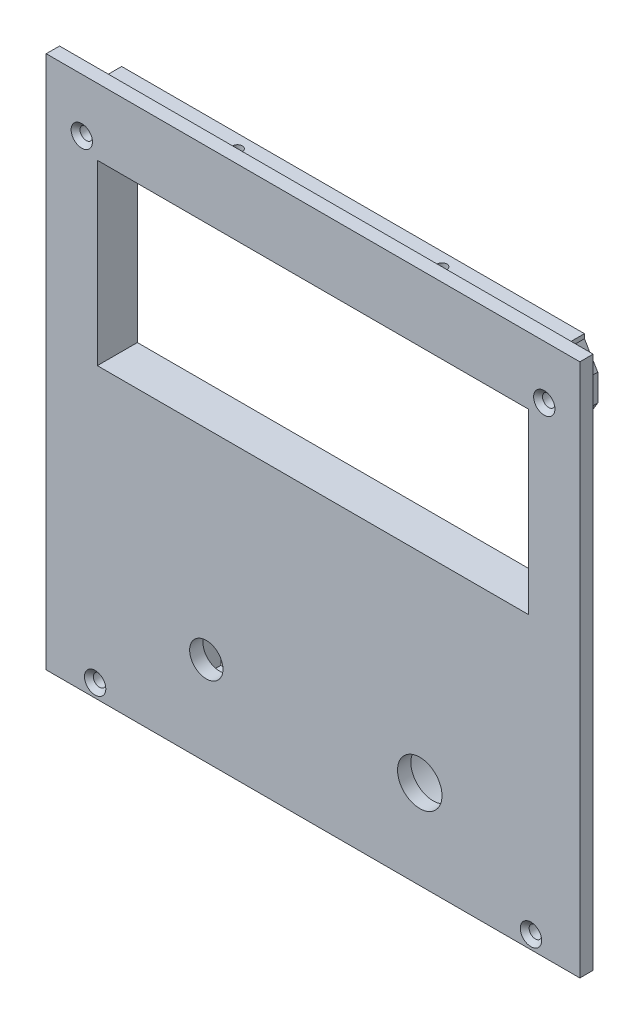
from build123d import *

# Parameters (mm, degrees)
SZKIC1_W                        = 120
SZKIC1_H                        = 120
SZKIC1_R                        = 3.75
SZKIC1_R_2                      = 5
SZKIC1_W_2                      = 97
SZKIC1_H_2                      = 40
DODANIE_WYCI_GNI_CIE1_DEPTH     = 3
SZKIC1_4_W                      = 17.2
SZKIC1_4_H                      = 32
DODANIE_WYCI_GNI_CIE3_DEPTH     = 6.5
SZKIC1_7_W                      = 97
SZKIC1_7_H                      = 40
DODANIE_WYCI_GNI_CIE4_DEPTH     = 7
SZKIC9_W                        = 40
SZKIC9_H                        = 4
WYTNIJ_WYCI_GNI_CIE10_DEPTH     = 1
SZKIC7_R                        = 1.4
WYTNIJ_WYCI_GNI_CIE11_DEPTH     = 10
SZKIC1_8_R                      = 13.25
SZKIC1_8_R_2                    = 11.25
DODANIE_WYCI_GNI_CIE5_DEPTH     = 19
SZKIC11_W                       = 17.2
SZKIC11_H                       = 3
WYTNIJ_WYCI_GNI_CIE13_DEPTH     = 4
SZKIC12_W                       = 12
SZKIC12_H                       = 19
WYTNIJ_WYCI_GNI_CIE14_DEPTH     = 4
SZKIC13_R                       = 1.1
WYTNIJ_WYCI_GNI_CIE15_DEPTH     = 7
SZKIC14_W                       = 6
SZKIC14_H                       = 6
SZKIC14_R                       = 1.1
DODANIE_WYCI_GNI_CIE6_DEPTH     = 0.8
DODANIE_WYCI_GNI_CIE7_DEPTH     = 0.8
SFAZOWANIE1_SIZE                = 1
SFAZOWANIE2_SIZE                = 1
SFAZOWANIE3_SIZE                = 1
SFAZOWANIE4_SIZE                = 1
SZKIC17_R                       = 1.4
DODANIE_WYCI_GNI_CIE9_DEPTH     = 6
SZKIC18_W                       = 99.4
SZKIC18_H                       = 63.2
WYTNIJ_WYCI_GNI_CIE16_DEPTH     = 1
WYTNIJ_WYCI_GNI_CIE17_START     = -5
WYTNIJ_WYCI_GNI_CIE17_OUTLINE_R = 1.1
WYTNIJ_WYCI_GNI_CIE17_DEPTH     = 4.2


# Read off the part's stored shape, not the designer's step: Wytnij-wyciągnięcie17
with BuildPart() as part:
    # Szkic1 → Dodanie-wyciągnięcie1 (new body)
    with BuildSketch(Plane.XY):
        with Locations((60, 60)):
            Rectangle(SZKIC1_W, SZKIC1_H)
        with Locations((36, 20)):
            Circle(SZKIC1_R, mode=Mode.SUBTRACT)
        with Locations((84, 20)):
            Circle(SZKIC1_R_2, mode=Mode.SUBTRACT)
        with Locations((60, 85)):
            Rectangle(SZKIC1_W_2, SZKIC1_H_2, mode=Mode.SUBTRACT)
    extrude(amount=DODANIE_WYCI_GNI_CIE1_DEPTH)

    # Szkic1<7> → Dodanie-wyciągnięcie4 (add)
    # profile 1 of 4: a face of its own
    with BuildSketch(Plane.XY):
        Polygon((11.5, 115), (10.3, 115), (10.3, 55), (11.5, 55), (108.5, 55), (109.7, 55), (109.7, 115), (108.5, 115), align=None)
        with Locations((60, 85)):
            Rectangle(SZKIC1_7_W, SZKIC1_7_H, mode=Mode.SUBTRACT)
    # profile 2 of 4: a face of its own
    with BuildSketch(Plane.XY):
        Polygon((11.5, 115), (10.3, 115), (10.3, 55), (11.5, 55), (108.5, 55), (109.7, 55), (109.7, 115), (108.5, 115), align=None)
        with Locations((60, 85)):
            Rectangle(SZKIC1_7_W, SZKIC1_7_H, mode=Mode.SUBTRACT)
    # profile 3 of 4: a face of its own
    with BuildSketch(Plane.XY):
        Polygon((11.5, 115), (10.3, 115), (10.3, 116.2), (109.7, 116.2), (109.7, 115), (108.5, 115), align=None)
    # profile 4 of 4: a face of its own
    with BuildSketch(Plane.XY):
        Polygon((10.3, 53.8), (109.7, 53.8), (109.7, 55), (108.5, 55), (11.5, 55), (10.3, 55), align=None)
    extrude(amount=-DODANIE_WYCI_GNI_CIE4_DEPTH)

    # Szkic9 → Wytnij-wyciągnięcie10 (cut)
    with BuildSketch(Plane(origin=(0, 0, -7), x_dir=(-1, 0, 0), z_dir=(0, 0, -1))):
        with Locations((-40.5, 113)):
            Rectangle(SZKIC9_W, SZKIC9_H)
    extrude(amount=-WYTNIJ_WYCI_GNI_CIE10_DEPTH, mode=Mode.SUBTRACT)

    # Szkic7 → Wytnij-wyciągnięcie11 (cut)
    with BuildSketch(Plane.XY.offset(3)):
        with Locations((11, 3)):
            Circle(SZKIC7_R)
        with Locations((109, 3)):
            Circle(SZKIC7_R)
        with Locations((8, 108)):
            Circle(SZKIC7_R)
        with Locations((112, 108)):
            Circle(SZKIC7_R)
    extrude(amount=-WYTNIJ_WYCI_GNI_CIE11_DEPTH, mode=Mode.SUBTRACT)

    # Szkic1<8> → Dodanie-wyciągnięcie5 (add)
    with BuildSketch(Plane.XY):
        with Locations((84, 20)):
            Circle(SZKIC1_8_R)
        with Locations((84, 20)):
            Circle(SZKIC1_8_R_2, mode=Mode.SUBTRACT)
    extrude(amount=-DODANIE_WYCI_GNI_CIE5_DEPTH)

    # Szkic12 → Wytnij-wyciągnięcie14 (cut)
    with BuildSketch(Plane(origin=(0, 33.25, 0), x_dir=(1, 0, 0), z_dir=(0, 1, 0))):
        with Locations((84, 9.5)):
            Rectangle(SZKIC12_W, SZKIC12_H)
    extrude(amount=-WYTNIJ_WYCI_GNI_CIE14_DEPTH, mode=Mode.SUBTRACT)

    # Szkic13 → Wytnij-wyciągnięcie15 (cut)
    with BuildSketch(Plane(origin=(0, 0, -7), x_dir=(-1, 0, 0), z_dir=(0, 0, -1))):
        with Locations((-106.5, 113)):
            Circle(SZKIC13_R)
        with Locations((-13.5, 113)):
            Circle(SZKIC13_R)
        with Locations((-106.5, 57)):
            Circle(SZKIC13_R)
        with Locations((-13.5, 57)):
            Circle(SZKIC13_R)
    extrude(amount=-WYTNIJ_WYCI_GNI_CIE15_DEPTH, mode=Mode.SUBTRACT)

    # Szkic14 → Dodanie-wyciągnięcie6 (add)
    # profile 1 of 2: a face of its own
    with BuildSketch(Plane(origin=(0, 116.2, 0), x_dir=(1, 0, 0), z_dir=(0, 1, 0))):
        with Locations((37, 3)):
            Rectangle(SZKIC14_W, SZKIC14_H)
        with Locations((37, 3)):
            Circle(SZKIC14_R, mode=Mode.SUBTRACT)
    # profile 2 of 2: a face of its own
    with BuildSketch(Plane(origin=(0, 116.2, 0), x_dir=(1, 0, 0), z_dir=(0, 1, 0))):
        with Locations((83, 3)):
            Rectangle(SZKIC14_W, SZKIC14_H)
        with Locations(Location((83, 3, 0), (0, 0, 180))):
            Circle(SZKIC14_R, mode=Mode.SUBTRACT)
    extrude(amount=DODANIE_WYCI_GNI_CIE6_DEPTH)

    # Szkic15 → Dodanie-wyciągnięcie7 (add)
    with BuildSketch(Plane(origin=(0, 116.2, 0), x_dir=(1, 0, 0), z_dir=(0, 1, 0))):
        Polygon((109.7, 0), (109.7, 7), (10.3, 7), (10.3, 0), (34, 0), (34, 6), (40, 6), (40, 0), (80, 0), (80, 6), (86, 6), (86, 0), align=None)
    extrude(amount=DODANIE_WYCI_GNI_CIE7_DEPTH)

    # Sfazowanie1
    sfazowanie1_edges = [part.edges().sort_by_distance(p)[0] for p in [
        (6.6, 108, 3),
    ]]
    chamfer(sfazowanie1_edges, length=SFAZOWANIE1_SIZE)

    # Sfazowanie2
    sfazowanie2_edges = [part.edges().sort_by_distance(p)[0] for p in [
        (110.6, 108, 3),
    ]]
    chamfer(sfazowanie2_edges, length=SFAZOWANIE2_SIZE)

    # Sfazowanie3
    sfazowanie3_edges = [part.edges().sort_by_distance(p)[0] for p in [
        (9.6, 3, 3),
    ]]
    chamfer(sfazowanie3_edges, length=SFAZOWANIE3_SIZE)

    # Sfazowanie4
    sfazowanie4_edges = [part.edges().sort_by_distance(p)[0] for p in [
        (107.6, 3, 3),
    ]]
    chamfer(sfazowanie4_edges, length=SFAZOWANIE4_SIZE)


with BuildPart() as body_2:
    # Szkic1<4> → Dodanie-wyciągnięcie3 (new body)
    with BuildSketch(Plane.XY):
        with Locations((36, 24)):
            Rectangle(SZKIC1_4_W, SZKIC1_4_H)
        Polygon((29.75, 11), (29.75, 26), (29.75, 29), (42.25, 29), (42.25, 26), (42.25, 11), align=None, mode=Mode.SUBTRACT)
    extrude(amount=-DODANIE_WYCI_GNI_CIE3_DEPTH)

    # Szkic11 → Wytnij-wyciągnięcie13 (cut)
    with BuildSketch(Plane(origin=(0, 0, -6.5), x_dir=(-1, 0, 0), z_dir=(0, 0, -1))):
        with Locations((-36, 38.5)):
            Rectangle(SZKIC11_W, SZKIC11_H)
    extrude(amount=-WYTNIJ_WYCI_GNI_CIE13_DEPTH, mode=Mode.SUBTRACT)


    add(part.part)  # Dodanie-wyciągnięcie9 merges part
    # Szkic17 → Dodanie-wyciągnięcie9 (add)
    with BuildSketch(Plane(origin=(0, 0, 0), x_dir=(-1, 0, 0), z_dir=(0, 0, -1))):
        Polygon((-106.03246961, 3), (-106.03246961, 6), (-109.03246961, 6), (-109.03246961, 117), (-112.03246961, 117), (-112.03246961, 116.010548872), (-115.03246961, 111), (-115.03246961, 105), (-112.03246961, 99.989451128), (-112.03246961, 0), (-7.96753039, 0), (-7.96753039, 99.989451128), (-4.96753039, 105), (-4.96753039, 111), (-7.96753039, 116.010548872), (-7.96753039, 117), (-10.96753039, 117), (-10.96753039, 6), (-14.03246961, 6), (-14.03246961, 3), align=None)
        with Locations(Location((-112, 108, 0), (0, 0, 180))):
            Circle(SZKIC17_R, mode=Mode.SUBTRACT)
        with Locations(Location((-8, 108, 0), (0, 0, 180))):
            Circle(SZKIC17_R, mode=Mode.SUBTRACT)
        with Locations(Location((-11, 3, 0), (0, 0, 180))):
            Circle(SZKIC17_R, mode=Mode.SUBTRACT)
        with Locations(Location((-109, 3, 0), (0, 0, 180))):
            Circle(SZKIC17_R, mode=Mode.SUBTRACT)
    extrude(amount=DODANIE_WYCI_GNI_CIE9_DEPTH)

    # Szkic18 → Wytnij-wyciągnięcie16 (cut)
    with BuildSketch(Plane(origin=(0, 0, -7), x_dir=(-1, 0, 0), z_dir=(0, 0, -1))):
        with Locations((-60, 85.4)):
            Rectangle(SZKIC18_W, SZKIC18_H)
    extrude(amount=-WYTNIJ_WYCI_GNI_CIE16_DEPTH, mode=Mode.SUBTRACT)

    # Wytnij-wyciągnięcie17 outline → Wytnij-wyciągnięcie17 (cut)
    with BuildSketch(Plane(origin=(0, 117, 0), x_dir=(1, 0, 0), z_dir=(0, 1, 0)).offset(WYTNIJ_WYCI_GNI_CIE17_START)):
        with Locations((37, 3)):
            Circle(WYTNIJ_WYCI_GNI_CIE17_OUTLINE_R)
        with Locations((83, 3)):
            Circle(WYTNIJ_WYCI_GNI_CIE17_OUTLINE_R)
    extrude(amount=WYTNIJ_WYCI_GNI_CIE17_DEPTH, mode=Mode.SUBTRACT)


solid = body_2.part
